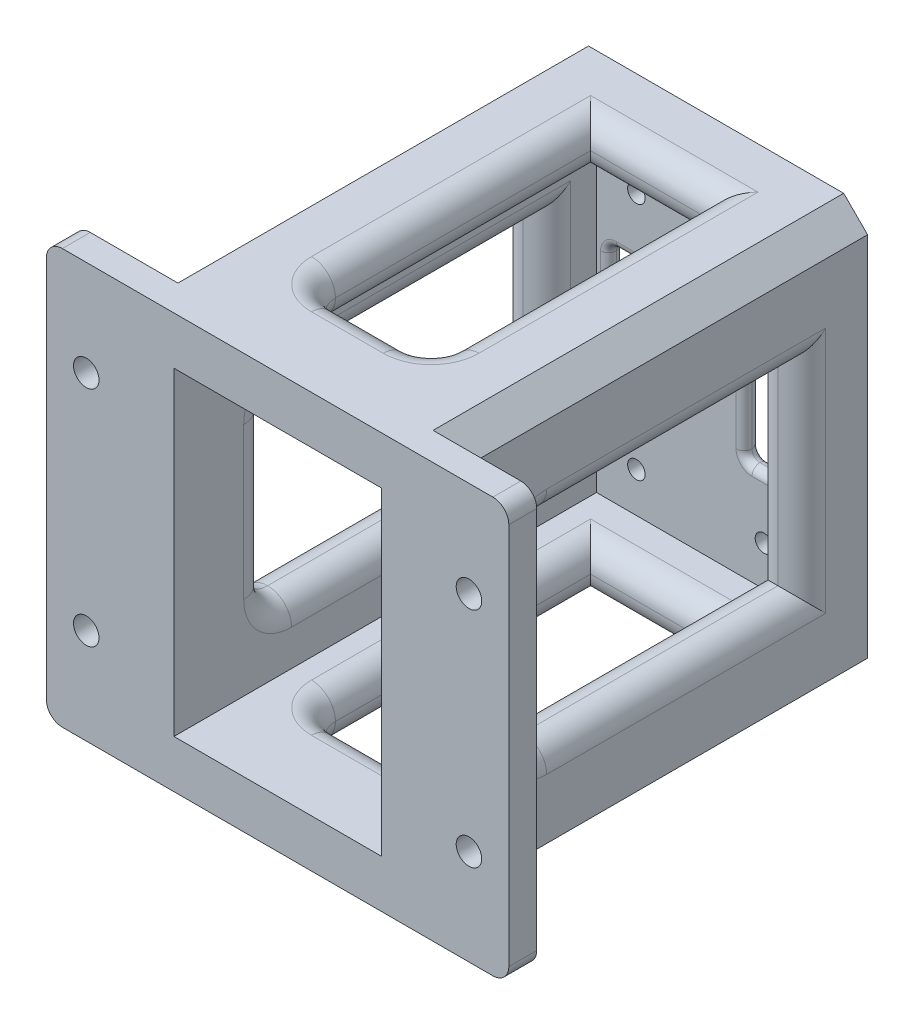
from build123d import *

# Parameters (mm, degrees)
SKETCH_1_W            = 26
SKETCH_1_H            = 40
EXTRUDE_1_DEPTH       = 2
CUT_EXTRUDE_1_REACH   = 31.526
SKETCH_1_3_R          = 1.1
SKETCH_1_4_W          = 38
SKETCH_1_4_H          = 52
SKETCH_1_4_W_2        = 26
SKETCH_1_4_H_2        = 40
EXTRUDE_2_DEPTH       = 55
EXTRUDE_START         = -3.5
EXTRUDE_1_2_OUTLINE_W = 10
EXTRUDE_1_2_OUTLINE_H = 52
EXTRUDE_1_2_DEPTH     = 3.5
SKETCH_3_4_W          = 10
SKETCH_3_4_H          = 52
EXTRUDE_2_2_DEPTH     = 3.5
CUT_EXTRUDE_2_REACH   = 72.447
SKETCH_3_5_R          = 1.6
FILLET_1_R            = 2
CHAMFER_1_SIZE        = 3
CUT_EXTRUDE_3_REACH   = 72.447
SKETCH_1_5_W          = 6
SKETCH_1_5_H          = 15
SKETCH_4_W            = 35
SKETCH_4_H            = 25
CUT_EXTRUDE_4_DEPTH   = 80.506289059
SKETCH_5_W            = 15
SKETCH_5_H            = 35
CUT_EXTRUDE_5_DEPTH   = 82.697995691
FILLET_2_R            = 3
FILLET_3_R            = 3
FILLET_4_R            = 1


# Read off the part's stored shape, not the designer's step: 拉伸-薄壁1
with BuildPart() as part:
    # 草图1 → Extrude 1 (new body)
    with BuildSketch(Plane.XY):
        with Locations((-1.75, 5.5)):
            Rectangle(SKETCH_1_W, SKETCH_1_H)
    extrude(amount=EXTRUDE_1_DEPTH)

    # 草图1<3> → 切除-拉伸1 (cut, up to next)
    with BuildSketch(Plane.XY, mode=Mode.PRIVATE) as cut_extrude_1_sk1:
        with Locations(Location((-9.75, 20.5, 0), (0, 0, 180))):
            Circle(SKETCH_1_3_R)
    cut_extrude_1_tool1 = extrude(cut_extrude_1_sk1.sketch, amount=CUT_EXTRUDE_1_REACH, mode=Mode.PRIVATE) & part.part
    # 草图1<3> → 切除-拉伸1 (cut, up to next)
    with BuildSketch(Plane.XY, mode=Mode.PRIVATE) as cut_extrude_1_sk2:
        with Locations(Location((6.25, 20.5, 0), (0, 0, 180))):
            Circle(SKETCH_1_3_R)
    cut_extrude_1_tool2 = extrude(cut_extrude_1_sk2.sketch, amount=CUT_EXTRUDE_1_REACH, mode=Mode.PRIVATE) & part.part
    # 草图1<3> → 切除-拉伸1 (cut, up to next)
    with BuildSketch(Plane.XY, mode=Mode.PRIVATE) as cut_extrude_1_sk3:
        with Locations(Location((-9.75, -9.5, 0), (0, 0, 180))):
            Circle(SKETCH_1_3_R)
    cut_extrude_1_tool3 = extrude(cut_extrude_1_sk3.sketch, amount=CUT_EXTRUDE_1_REACH, mode=Mode.PRIVATE) & part.part
    # 草图1<3> → 切除-拉伸1 (cut, up to next)
    with BuildSketch(Plane.XY, mode=Mode.PRIVATE) as cut_extrude_1_sk4:
        with Locations(Location((6.25, -9.5, 0), (0, 0, 180))):
            Circle(SKETCH_1_3_R)
    cut_extrude_1_tool4 = extrude(cut_extrude_1_sk4.sketch, amount=CUT_EXTRUDE_1_REACH, mode=Mode.PRIVATE) & part.part
    add(cut_extrude_1_tool1.solids().sort_by_distance((-9.75, 20.5, 0))[0], mode=Mode.SUBTRACT)
    add(cut_extrude_1_tool2.solids().sort_by_distance((6.25, 20.5, 0))[0], mode=Mode.SUBTRACT)
    add(cut_extrude_1_tool3.solids().sort_by_distance((-9.75, -9.5, 0))[0], mode=Mode.SUBTRACT)
    add(cut_extrude_1_tool4.solids().sort_by_distance((6.25, -9.5, 0))[0], mode=Mode.SUBTRACT)

    # 草图1<4> → Extrude 2 (add)
    with BuildSketch(Plane.XY):
        with Locations((-1.75, 5.5)):
            Rectangle(SKETCH_1_4_W, SKETCH_1_4_H)
        with Locations((-1.75, 5.5)):
            Rectangle(SKETCH_1_4_W_2, SKETCH_1_4_H_2, mode=Mode.SUBTRACT)
    extrude(amount=EXTRUDE_2_DEPTH)

    # Extrude 1 2 outline → Extrude 1 2 (add)
    with BuildSketch(Plane.XY.offset(55).offset(EXTRUDE_START)):
        with Locations((-25.75, 5.5)):
            Rectangle(EXTRUDE_1_2_OUTLINE_W, EXTRUDE_1_2_OUTLINE_H)
    extrude(amount=EXTRUDE_1_2_DEPTH)

    # 草图3<4> → Extrude 2 2 (add)
    with BuildSketch(Plane.XY.offset(55)):
        with Locations((22.25, 5.5)):
            Rectangle(SKETCH_3_4_W, SKETCH_3_4_H)
    extrude(amount=-EXTRUDE_2_2_DEPTH)

    # 草图3<5> → 切除-拉伸2 (cut, up to next)
    with BuildSketch(Plane.XY.offset(55), mode=Mode.PRIVATE) as cut_extrude_2_sk1:
        with Locations((-25.75, 19.5)):
            Circle(SKETCH_3_5_R)
    cut_extrude_2_tool1 = extrude(cut_extrude_2_sk1.sketch, amount=-CUT_EXTRUDE_2_REACH, mode=Mode.PRIVATE) & part.part
    # 草图3<5> → 切除-拉伸2 (cut, up to next)
    with BuildSketch(Plane.XY.offset(55), mode=Mode.PRIVATE) as cut_extrude_2_sk2:
        with Locations((22.25, 19.5)):
            Circle(SKETCH_3_5_R)
    cut_extrude_2_tool2 = extrude(cut_extrude_2_sk2.sketch, amount=-CUT_EXTRUDE_2_REACH, mode=Mode.PRIVATE) & part.part
    # 草图3<5> → 切除-拉伸2 (cut, up to next)
    with BuildSketch(Plane.XY.offset(55), mode=Mode.PRIVATE) as cut_extrude_2_sk3:
        with Locations((-25.75, -8.5)):
            Circle(SKETCH_3_5_R)
    cut_extrude_2_tool3 = extrude(cut_extrude_2_sk3.sketch, amount=-CUT_EXTRUDE_2_REACH, mode=Mode.PRIVATE) & part.part
    # 草图3<5> → 切除-拉伸2 (cut, up to next)
    with BuildSketch(Plane.XY.offset(55), mode=Mode.PRIVATE) as cut_extrude_2_sk4:
        with Locations((22.25, -8.5)):
            Circle(SKETCH_3_5_R)
    cut_extrude_2_tool4 = extrude(cut_extrude_2_sk4.sketch, amount=-CUT_EXTRUDE_2_REACH, mode=Mode.PRIVATE) & part.part
    add(cut_extrude_2_tool1.solids().sort_by_distance((-25.75, 19.5, 55))[0], mode=Mode.SUBTRACT)
    add(cut_extrude_2_tool2.solids().sort_by_distance((22.25, 19.5, 55))[0], mode=Mode.SUBTRACT)
    add(cut_extrude_2_tool3.solids().sort_by_distance((-25.75, -8.5, 55))[0], mode=Mode.SUBTRACT)
    add(cut_extrude_2_tool4.solids().sort_by_distance((22.25, -8.5, 55))[0], mode=Mode.SUBTRACT)

    # 圆角1
    fillet_1_edges = [part.edges().sort_by_distance(p)[0] for p in [
        (-30.75, -20.5, 53.25),
        (-30.75, 31.5, 53.25),
        (27.25, 31.5, 53.25),
        (27.25, -20.5, 53.25),
    ]]
    fillet(fillet_1_edges, radius=FILLET_1_R)

    # 倒角1
    chamfer_1_edges = [part.edges().sort_by_distance(p)[0] for p in [
        (-20.75, -20.5, 25.75),
        (-20.75, 31.5, 25.75),
        (17.25, 31.5, 25.75),
        (17.25, -20.5, 25.75),
    ]]
    chamfer(chamfer_1_edges, length=CHAMFER_1_SIZE)

    # 草图1<5> → 切除-拉伸3 (cut, up to next)
    with BuildSketch(Plane.XY, mode=Mode.PRIVATE) as cut_extrude_3_sk1:
        with Locations((-10.25, 5.5)):
            Rectangle(SKETCH_1_5_W, SKETCH_1_5_H)
    cut_extrude_3_tool1 = extrude(cut_extrude_3_sk1.sketch, amount=CUT_EXTRUDE_3_REACH, mode=Mode.PRIVATE) & part.part
    # 草图1<5> → 切除-拉伸3 (cut, up to next)
    with BuildSketch(Plane.XY, mode=Mode.PRIVATE) as cut_extrude_3_sk2:
        with Locations((6.75, 5.5)):
            Rectangle(SKETCH_1_5_W, SKETCH_1_5_H)
    cut_extrude_3_tool2 = extrude(cut_extrude_3_sk2.sketch, amount=CUT_EXTRUDE_3_REACH, mode=Mode.PRIVATE) & part.part
    add(cut_extrude_3_tool1.solids().sort_by_distance((-10.25, 5.5, 0))[0], mode=Mode.SUBTRACT)
    add(cut_extrude_3_tool2.solids().sort_by_distance((6.75, 5.5, 0))[0], mode=Mode.SUBTRACT)

    # 草图4 → 切除-拉伸4 (cut, through all)
    with BuildSketch(Plane(origin=(17.25, 0, 0), x_dir=(0, 0, -1), z_dir=(1, 0, 0))):
        with Locations((-25.75, 5.5)):
            Rectangle(SKETCH_4_W, SKETCH_4_H)
    extrude(amount=-CUT_EXTRUDE_4_DEPTH, mode=Mode.SUBTRACT)

    # 草图5 → 切除-拉伸5 (cut, through all)
    with BuildSketch(Plane.XZ.offset(20.5)):
        with Locations((-1.75, 25.75)):
            Rectangle(SKETCH_5_W, SKETCH_5_H)
    extrude(amount=-CUT_EXTRUDE_5_DEPTH, mode=Mode.SUBTRACT)

    # 圆角2
    fillet_2_edges = [part.edges().sort_by_distance(p)[0] for p in [
        (-17.75, -7, 43.25),
        (14.25, -7, 43.25),
        (-17.75, 18, 43.25),
        (14.25, 18, 43.25),
        (-9.25, 28.5, 43.25),
        (5.75, 28.5, 43.25),
        (-9.25, -17.5, 43.25),
        (5.75, -17.5, 43.25),
    ]]
    fillet(fillet_2_edges, radius=FILLET_2_R)

    # 圆角3
    fillet_3_edges = [part.edges().sort_by_distance(p)[0] for p in [
        (11.25, 18, 24.25),
        (11.25, -7, 24.25),
        (11.25, -6.121320344, 42.371320344),
        (11.25, 5.5, 43.25),
        (17.25, -7, 24.25),
        (17.25, -6.121320344, 42.371320344),
        (17.25, 5.5, 43.25),
        (17.25, 17.121320344, 42.371320344),
        (-9.25, -14.5, 24.25),
        (-8.371320344, -14.5, 42.371320344),
        (-1.75, -14.5, 43.25),
        (4.871320344, -14.5, 42.371320344),
        (-9.25, -20.5, 24.25),
        (-8.371320344, -20.5, 42.371320344),
        (-1.75, -20.5, 43.25),
        (4.871320344, -20.5, 42.371320344),
        (-9.25, 25.5, 24.25),
        (-8.371320344, 25.5, 42.371320344),
        (-1.75, 25.5, 43.25),
        (4.871320344, 25.5, 42.371320344),
        (5.75, 31.5, 24.25),
        (4.871320344, 31.5, 42.371320344),
        (-1.75, 31.5, 43.25),
        (-8.371320344, 31.5, 42.371320344),
        (-14.75, 18, 24.25),
        (-14.75, 17.121320344, 42.371320344),
        (-14.75, 5.5, 43.25),
        (-14.75, -6.121320344, 42.371320344),
        (-20.75, 18, 24.25),
        (-20.75, 17.121320344, 42.371320344),
        (-20.75, 5.5, 43.25),
        (-20.75, -6.121320344, 42.371320344),
        (11.25, 17.121320344, 42.371320344),
        (17.25, 18, 24.25),
        (11.25, 5.5, 8.25),
        (17.25, 5.5, 8.25),
        (5.75, -14.5, 24.25),
        (5.75, -20.5, 24.25),
        (-1.75, -14.5, 8.25),
        (-1.75, -20.5, 8.25),
        (-1.75, 25.5, 8.25),
        (5.75, 25.5, 24.25),
        (-9.25, 31.5, 24.25),
        (-1.75, 31.5, 8.25),
        (-14.75, 5.5, 8.25),
        (-14.75, -7, 24.25),
        (-20.75, 5.5, 8.25),
        (-20.75, -7, 24.25),
    ]]
    fillet(fillet_3_edges, radius=FILLET_3_R - 0.0001)  # a hair under: the kernel refuses the full size

    # 圆角4
    fillet_4_edges = [part.edges().sort_by_distance(p)[0] for p in [
        (9.75, -2, 1),
        (6.75, 13, 2),
        (9.75, 13, 1),
        (6.75, 13, 0),
        (3.75, 5.5, 2),
        (3.75, 13, 1),
        (3.75, 5.5, 0),
        (3.75, -2, 1),
        (9.75, 5.5, 0),
        (6.75, -2, 0),
        (6.75, -2, 2),
        (9.75, 5.5, 2),
        (-13.25, 5.5, 2),
        (-13.25, 13, 1),
        (-13.25, 5.5, 0),
        (-10.25, -2, 2),
        (-13.25, -2, 1),
        (-10.25, -2, 0),
        (-7.25, -2, 1),
        (-7.25, 13, 1),
        (-10.25, 13, 0),
        (-7.25, 5.5, 0),
        (-7.25, 5.5, 2),
        (-10.25, 13, 2),
    ]]
    fillet(fillet_4_edges, radius=FILLET_4_R - 0.0001)  # a hair under: the kernel refuses the full size


solid = part.part
